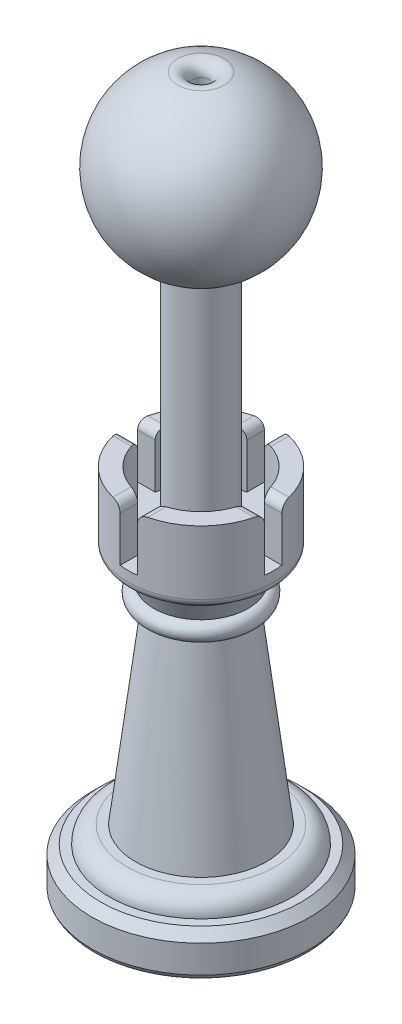
from build123d import *

# Parameters (mm, degrees)
CHAMFER1_SIZE      = 0.762
FILLET1_R          = 0.762
CUT_EXTRUDE4_START = -4.699
CUT_EXTRUDE4_DEPTH = 4.699
FILLET2_R          = 0.762
FILLET3_R          = 1.524
SKETCH5_ONE_SIDE_W = 2.5
SKETCH5_ONE_SIDE_H = 22.682
SKETCH6_R          = 0.75
CUT_EXTRUDE5_DEPTH = 65
SKETCH7_R          = 5.1000000000000005
CUT_EXTRUDE6_DEPTH = 4
FILLET4_R          = 1


# Some blends are built 0.0001 mm under size
with BuildPart() as part:
    # Sketch1 → Revolve1 (revolve)
    with BuildSketch(Plane.XY, mode=Mode.PRIVATE) as revolve1_sk:
        with BuildLine():
            Line((0, 0), (0, 31.75))
            Line((0, 31.75), (-6.35, 31.75))
            Line((-6.35, 31.75), (-6.349999999999998, 25.4))
            Line((-6.349999999999998, 25.4), (-4.825999999999998, 25.4))
            Line((-4.825999999999998, 25.4), (-4.825999999999998, 24.638))
            Line((-4.825999999999998, 24.638), (-4.112783335413436, 23.0632))
            ThreePointArc((-4.112783335413436, 23.0632), (-4.874783335413493, 22.301200000000033), (-4.112783335413496, 21.539199999999997))
            Line((-4.112783335413496, 21.539199999999997), (-3.683, 21.539199999999997))
            Line((-3.683, 21.539199999999997), (-5.715, 4.699))
            Line((-5.715, 4.699), (-8.001, 4.699))
            Line((-8.001, 4.699), (-8.001, 3.1749999999999994))
            Line((-8.001, 3.1749999999999994), (-9.524999999999999, 3.175))
            Line((-9.524999999999999, 3.175), (-9.525, 0))
            Line((-9.525, 0), (0, 0))
        make_face()
    revolve(revolve1_sk.sketch.rotate(Axis((0, 0, 0), (0, 1, 0)), 270), axis=Axis((0, 0, 0), (0, 1, 0)))

    # Chamfer1
    chamfer1_edges = [part.edges().sort_by_distance(p)[0] for p in [
        (-3.28e-15, 3.175, 9.524999999999999),
    ]]
    chamfer(chamfer1_edges, length=CHAMFER1_SIZE)

    # Fillet1
    fillet1_edges = [part.edges().sort_by_distance(p)[0] for p in [
        (-1.66e-15, 25.4, 4.825999999999998),
        (-2.19e-15, 25.4, 6.349999999999998),
    ]]
    fillet(fillet1_edges, radius=FILLET1_R - 0.0001)  # a hair under: the kernel refuses the full size

    # Sketch2 → Cut-Extrude4 (cut)
    with BuildSketch(Plane(origin=(0, 31.75, 0), x_dir=(1, 0, 0), z_dir=(0, 1, 0)).offset(CUT_EXTRUDE4_START)):
        with BuildLine():
            Line((0.7619999999999992, 4.765462411980587), (0.7619999999999998, 0.7620000000000005))
            Line((0.7620000000000005, 0.7620000000000001), (4.765462411980588, 0.7620000000000001))
            ThreePointArc((4.765462411980596, 0.7620000000000517), (3.41249732600628, 3.4124973260062763), (0.7620000000000579, 4.765462411980595))
        make_face()
        with BuildLine():
            ThreePointArc((-0.7619999999999283, 4.765462411980615), (-3.4124973260062657, 3.4124973260062905), (-4.765462411980609, 0.761999999999965))
            Line((-4.765462411980616, 0.7620000000000001), (-0.7620000000000005, 0.7620000000000001))
            Line((-0.7620000000000001, 0.7620000000000005), (-0.7620000000000007, 4.765462411980627))
        make_face()
        with BuildLine():
            Line((-0.7620000000000005, -0.7619999999999999), (-4.765462411980616, -0.7619999999999999))
            ThreePointArc((-4.76546241198061, -0.7619999999999638), (-3.4124973260062665, -3.4124973260062896), (-0.7619999999999294, -4.765462411980615))
            Line((-0.7619999999999995, -4.765462411980625), (-0.762, -0.7620000000000005))
        make_face()
        with BuildLine():
            Line((4.765462411980588, -0.7619999999999999), (0.7620000000000005, -0.7619999999999999))
            Line((0.7619999999999999, -0.7620000000000005), (0.7620000000000005, -4.765462411980586))
            ThreePointArc((0.7620000000000589, -4.765462411980595), (3.4124973260062803, -3.4124973260062754), (4.765462411980596, -0.7620000000000524))
        make_face()
        with BuildLine():
            Line((-4.765462411980616, 0.7620000000000001), (-6.304114212163325, 0.7620000000000001))
            ThreePointArc((-6.30411421216334, 0.7620000000001262), (-6.35, 7.8e-16), (-6.30411421216334, -0.7620000000001247))
            Line((-6.3041142121633245, -0.7619999999999999), (-4.765462411980616, -0.7619999999999999))
            ThreePointArc((-4.76546241198061, -0.7619999999999638), (-4.826, 5.9e-16), (-4.765462411980609, 0.761999999999965))
        make_face()
        with BuildLine():
            ThreePointArc((6.35, 0), (6.338518172539906, 0.38169015756418134), (6.3041142121633476, 0.7620000000000579))
            Line((6.30411421216334, 0.7620000000000001), (4.765462411980588, 0.7620000000000001))
            ThreePointArc((4.765462411980596, 0.7620000000000517), (4.81084179745179, 0.3822004708144948), (4.826, 0))
            ThreePointArc((4.826, -1.18e-15), (4.810841797451791, -0.3822004708144936), (4.765462411980596, -0.7620000000000524))
            Line((4.765462411980588, -0.7619999999999999), (6.30411421216334, -0.7619999999999999))
            ThreePointArc((6.3041142121633476, -0.7620000000000626), (6.338518172539906, -0.38169015756418173), (6.35, -1.56e-15))
        make_face()
        with BuildLine():
            ThreePointArc((0.7619999999999425, 6.304114212163362), (-3.345e-14, 6.35), (-0.7620000000000103, 6.304114212163354))
            Line((-0.7620000000000008, 6.304114212163352), (-0.7620000000000007, 4.765462411980627))
            ThreePointArc((-0.7619999999999283, 4.765462411980615), (6.459e-14, 4.826), (0.7620000000000569, 4.765462411980595))
            Line((0.7619999999999992, 4.765462411980587), (0.7619999999999991, 6.304114212163368))
        make_face()
        with BuildLine():
            Line((-0.7619999999999995, -4.765462411980625), (-0.7619999999999993, -6.304114212163352))
            ThreePointArc((-0.7620000000000118, -6.304114212163354), (-3.501e-14, -6.35), (0.7619999999999423, -6.304114212163362))
            Line((0.7620000000000006, -6.30411421216337), (0.7620000000000005, -4.765462411980586))
            ThreePointArc((0.7620000000000589, -4.765462411980595), (6.77e-14, -4.826), (-0.7619999999999294, -4.765462411980615))
        make_face()
        with BuildLine():
            Line((0.7620000000000005, -0.7619999999999999), (-0.7620000000000005, -0.7619999999999999))
            Line((-0.762, -0.7620000000000005), (-0.7619999999999995, -4.765462411980625))
            ThreePointArc((-0.7619999999999294, -4.765462411980615), (6.77e-14, -4.826), (0.7620000000000589, -4.765462411980595))
            Line((0.7620000000000005, -4.765462411980586), (0.7619999999999999, -0.7620000000000005))
        make_face()
        Polygon((0.7620000000000005, 0.7620000000000001), (-0.7620000000000005, 0.7620000000000001), (-0.762, -0.7620000000000005), (0.7620000000000005, -0.7619999999999999), align=None)
        with BuildLine():
            Line((-0.7620000000000005, 0.7620000000000001), (-4.765462411980616, 0.7620000000000001))
            ThreePointArc((-4.765462411980609, 0.761999999999965), (-4.826, 5.9e-16), (-4.76546241198061, -0.7619999999999638))
            Line((-4.765462411980616, -0.7619999999999999), (-0.7620000000000005, -0.7619999999999999))
            Line((-0.762, -0.7620000000000005), (-0.7620000000000001, 0.7620000000000005))
        make_face()
        with BuildLine():
            Line((-0.7620000000000007, 4.765462411980627), (-0.7620000000000001, 0.7620000000000005))
            Line((-0.7620000000000005, 0.7620000000000001), (0.7620000000000005, 0.7620000000000001))
            Line((0.7619999999999998, 0.7620000000000005), (0.7619999999999992, 4.765462411980587))
            ThreePointArc((0.7620000000000569, 4.765462411980595), (6.459e-14, 4.826), (-0.7619999999999283, 4.765462411980615))
        make_face()
        with BuildLine():
            Line((4.765462411980588, 0.7620000000000001), (0.7620000000000005, 0.7620000000000001))
            Line((0.7619999999999998, 0.7620000000000005), (0.7619999999999999, -0.7620000000000005))
            Line((0.7620000000000005, -0.7619999999999999), (4.765462411980588, -0.7619999999999999))
            ThreePointArc((4.765462411980596, -0.7620000000000524), (4.810841797451791, -0.3822004708144936), (4.826, -1.18e-15))
            ThreePointArc((4.826, 0), (4.81084179745179, 0.3822004708144948), (4.765462411980596, 0.7620000000000517))
        make_face()
    extrude(amount=CUT_EXTRUDE4_DEPTH, mode=Mode.SUBTRACT)

    # Fillet2
    fillet2_edges = [part.edges().sort_by_distance(p)[0] for p in [
        (5.534788312071964, 31.75, -0.7620000000000001),
        (0.7620000000000005, 31.75, 5.534788312071978),
        (-5.534788312071971, 31.75, -0.7620000000000001),
        (0.7619999999999991, 31.75, -5.534788312071978),
        (-0.7620000000000007, 31.75, -5.534788312071989),
        (-5.534788312071971, 31.75, 0.7619999999999999),
        (-0.7619999999999993, 31.75, 5.5347883120719885),
        (5.534788312071964, 31.75, 0.7619999999999999),
    ]]
    fillet(fillet2_edges, radius=FILLET2_R)

    # Fillet3
    fillet3_edges = [part.edges().sort_by_distance(p)[0] for p in [
        (-2.76e-15, 4.699, 8.001),
    ]]
    fillet(fillet3_edges, radius=FILLET3_R - 0.0001)  # a hair under: the kernel refuses the full size

    # Sketch5 one side → Revolve3 (revolve)
    with BuildSketch(Plane.XY):
        with BuildLine():
            Line((0, 46.89106781186547), (0, 61.89106781186547))
            ThreePointArc((2.0363e-13, 61.891067811865476), (-7.5, 54.391067811865476), (2.0512e-13, 46.891067811865476))
        make_face()
        Polygon((0, 0), (-10, -1.22e-15), (-5.37, -2.68), (0, -2.680000000000002), align=None)
        with Locations((-1.25, 35.979)):
            Rectangle(SKETCH5_ONE_SIDE_W, SKETCH5_ONE_SIDE_H)
    revolve(axis=Axis((0, 24.638, 0), (0, 1, 0)))

    # Sketch6 → Cut-Extrude5 (cut)
    with BuildSketch(Plane.XZ.offset(2.680000000000001)):
        with Locations(Location((0, 0, 0), (0, 0, 270))):
            Circle(SKETCH6_R)
    extrude(amount=-CUT_EXTRUDE5_DEPTH, mode=Mode.SUBTRACT)

    # Sketch7 → Cut-Extrude6 (cut)
    with BuildSketch(Plane.XZ.offset(2.680000000000001)):
        with Locations(Location((0, 0, 0), (0, 0, 270))):
            Circle(SKETCH7_R)
    extrude(amount=-CUT_EXTRUDE6_DEPTH, mode=Mode.SUBTRACT)

    # Fillet4
    # the kernel refuses this fillet: 1 mm, written as the material it takes off along each edge
    with BuildSketch(Plane(origin=(0, 0, 0), x_dir=(-1, 0, 0), z_dir=(0, 0, -1))) as fillet4_piece_1:
        with BuildLine():
            CenterArc((8.582830845240165, 0.3351377087394656), FILLET4_R, 300.06370450944223, 40.35538333384966)
            Line((9.08379342931, -0.5303312331423761), (10, 0))
            Line((10, 0), (9.525, 1.7e-16))
        make_face()
    revolve(axis=Axis((0, 0, 0), (0, 1, 0)), mode=Mode.SUBTRACT)
    with BuildSketch(Plane(origin=(2.2e-16, 61.85347359016512, 0), x_dir=(-1, 0, 1.8e-16), z_dir=(1.8e-16, 0, 1))) as fillet4_piece_2:
        with BuildLine():
            CenterArc((1.7500000000000002, 1.2024137655251934), FILLET4_R, 180, 105.6184982756485)
            ThreePointArc((2.019230769230769, 0.23933807125219886), (1.3897771193257187, 0.09229590404412846), (0.75, 0))
            Line((0.75, 0), (0.7500000000000002, 1.2024137655251934))
        make_face()
    revolve(axis=Axis((2.2e-16, 61.85347359016512, 0), (0, -1, 0)), revolution_arc=90, mode=Mode.SUBTRACT)
    with BuildSketch(Plane(origin=(0, -2.680000000000001, 0), x_dir=(-1.8e-16, 0, -1), z_dir=(-1, 0, 1.8e-16))) as fillet4_piece_3:
        with BuildLine():
            CenterArc((6.1000000000000005, -0.6834471449936719), FILLET4_R, 136.88639405410134, 43.113605945898655)
            Line((5.1000000000000005, -0.6834471449936719), (5.1000000000000005, 0))
            Line((5.1000000000000005, 0), (5.37, -1.33e-15))
        make_face()
    revolve(axis=Axis((0, -2.680000000000001, 0), (0, -1, 0)), mode=Mode.SUBTRACT)
    with BuildSketch(Plane(origin=(2.2e-16, 61.85347359016512, 0), x_dir=(0, 0, -1), z_dir=(-1, 0, 0))) as fillet4_piece_4:
        with BuildLine():
            CenterArc((1.75, 1.2024137655251934), FILLET4_R, 180, 105.6184982756485)
            ThreePointArc((2.0192307692307687, 0.23933807125219886), (1.3897771193257187, 0.09229590404412846), (0.75, 0))
            Line((0.75, 0), (0.75, 1.2024137655251934))
        make_face()
    revolve(axis=Axis((2.2e-16, 61.85347359016512, 0), (0, -1, 0)), revolution_arc=270, mode=Mode.SUBTRACT)


solid = part.part
